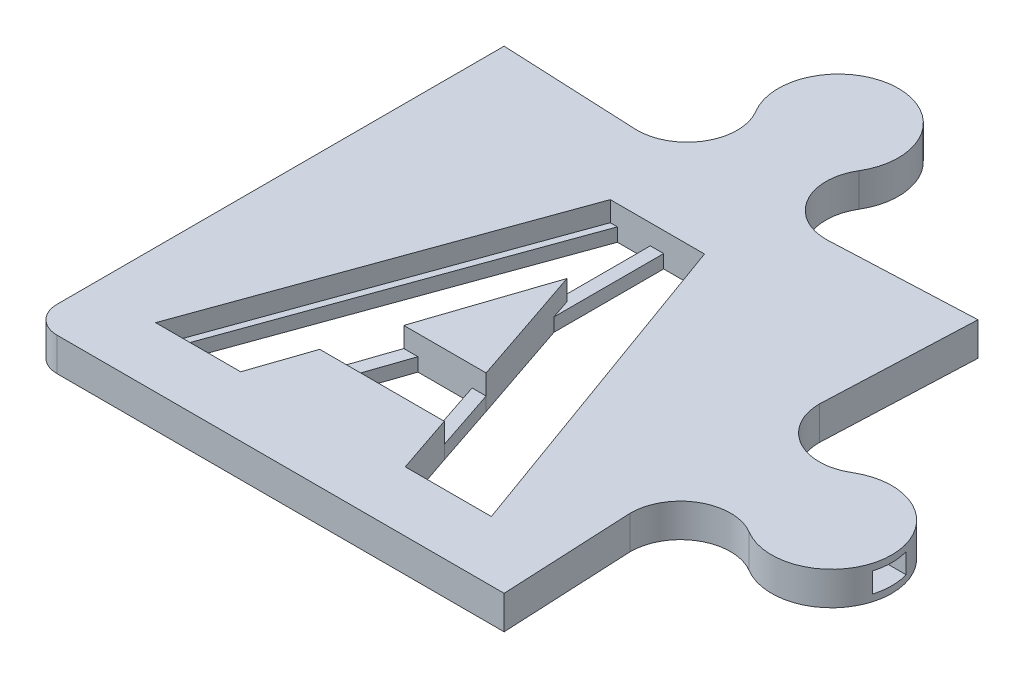
from build123d import *

# Parameters (mm, degrees)
BOSS_EXTRUDE1_DEPTH = 5
CUT_EXTRUDE1_DEPTH  = 3
CUT_EXTRUDE2_DEPTH  = 85.905830188
CUT_EXTRUDE3_START  = -1
SKETCH6_W           = 8
SKETCH6_H           = 34
CUT_EXTRUDE3_DEPTH  = 3
CUT_EXTRUDE4_REACH  = 87
SKETCH6_3_W         = 5
SKETCH6_3_H         = 27.5
CUT_EXTRUDE5_START  = -1
SKETCH8_W           = 5
SKETCH8_H           = 9
SKETCH8_W_2         = 9
SKETCH8_H_2         = 5
CUT_EXTRUDE5_DEPTH  = 3


with BuildPart() as part:
    # Sketch1 → Boss-Extrude1 (new body)
    with BuildSketch(Plane(origin=(0, 0, 0), x_dir=(1, 0, 0), z_dir=(0, 1, 0))):
        with BuildLine():
            Line((-35, 35.953203886), (-35, -31))
            ThreePointArc((-35, -31), (-33.828427125, -33.828427125), (-31, -35))
            Line((-31, -35), (35.950907821, -35))
            Line((35.950907821, -35), (35.00004105, -15.16694985))
            ThreePointArc((35.00004105, -15.16694985), (38.796461303, -8.620341306), (46.363636364, -8.713892158))
            ThreePointArc((46.363636364, -8.713892158), (60, -1), (46.363636364, 6.713892158))
            ThreePointArc((46.363636364, 6.713892158), (38.797816712, 6.619571795), (35.000031384, 13.163832634))
            Line((35.000031384, 13.163832634), (35.955251188, 35.953337169))
            Line((35.955251188, 35.953337169), (14.164780928, 35.000034187))
            ThreePointArc((14.164780928, 35.000034187), (7.619805859, 38.797404364), (7.713892158, 46.363636364))
            ThreePointArc((7.713892158, 46.363636364), (0, 60), (-7.713892158, 46.363636364))
            ThreePointArc((-7.713892158, 46.363636364), (-7.620061337, 38.796954361), (-14.165815855, 35.000037384))
            Line((-14.165815855, 35.000037384), (-35, 35.953203886))
        make_face()
    extrude(amount=BOSS_EXTRUDE1_DEPTH)

    # Sketch3 → Cut-Extrude1 (cut)
    with BuildSketch(Plane(origin=(0, 5, 0), x_dir=(1, 0, 0), z_dir=(0, 1, 0))):
        Polygon((9.161170651, -17.168590272), (-9.501236603, -17.168590272), (-12.489694971, -26), (-25.237015664, -26), (-7.151690025, 24), (6.955894477, 24), (25.041220115, -26), (12.149629019, -26), align=None)
        Polygon((6.02844188, -7.770403957), (-0.164880462, 10.541632317), (-6.29637263, -7.770403957), align=None, mode=Mode.SUBTRACT)
    extrude(amount=-CUT_EXTRUDE1_DEPTH, mode=Mode.SUBTRACT)

    # Sketch4 → Cut-Extrude2 (cut, through all)
    with BuildSketch(Plane(origin=(0, 2, 0), x_dir=(1, 0, 0), z_dir=(0, 1, 0))):
        Polygon((-6.29637263, -7.770403957), (-1.159863739, 7.57006041), (-1.159863739, 24), (-6.088284363, 24), (-24.173610002, -26), (-12.489694971, -26), (-9.501236603, -17.168590272), align=None)
        Polygon((0.840136261, 24), (0.840136261, 7.57006041), (6.02844188, -7.770403957), (9.161170651, -17.168590272), (12.149629019, -26), (23.977814454, -26), (5.892488815, 24), align=None)
        Polygon((3.920256773, -7.770403957), (-4.183282965, -7.770403957), (-7.388146939, -17.168590272), (7.052985544, -17.168590272), align=None)
    extrude(amount=-CUT_EXTRUDE2_DEPTH, mode=Mode.SUBTRACT)

    # Sketch6 → Cut-Extrude3 (cut)
    with BuildSketch(Plane.XZ.offset(CUT_EXTRUDE3_START)):
        with Locations((-31, 1)):
            Rectangle(SKETCH6_W, SKETCH6_H)
    extrude(amount=-CUT_EXTRUDE3_DEPTH, mode=Mode.SUBTRACT)

    # Sketch6<3> → Cut-Extrude4 (cut, up to next)
    with BuildSketch(Plane.XZ, mode=Mode.PRIVATE) as cut_extrude4_sk1:
        with Locations((-32.5, 1)):
            Rectangle(SKETCH6_3_W, SKETCH6_3_H)
    cut_extrude4_tool1 = extrude(cut_extrude4_sk1.sketch, amount=-CUT_EXTRUDE4_REACH, mode=Mode.PRIVATE) & part.part
    add(cut_extrude4_tool1.solids().sort_by_distance((-32.5, 0, 1))[0], mode=Mode.SUBTRACT)

    # Sketch8 → Cut-Extrude5 (cut)
    with BuildSketch(Plane.XZ.offset(CUT_EXTRUDE5_START)):
        with Locations((0, -55.5)):
            Rectangle(SKETCH8_W, SKETCH8_H)
        with Locations((55.5, 1)):
            Rectangle(SKETCH8_W_2, SKETCH8_H_2)
    extrude(amount=-CUT_EXTRUDE5_DEPTH, mode=Mode.SUBTRACT)


solid = part.part
